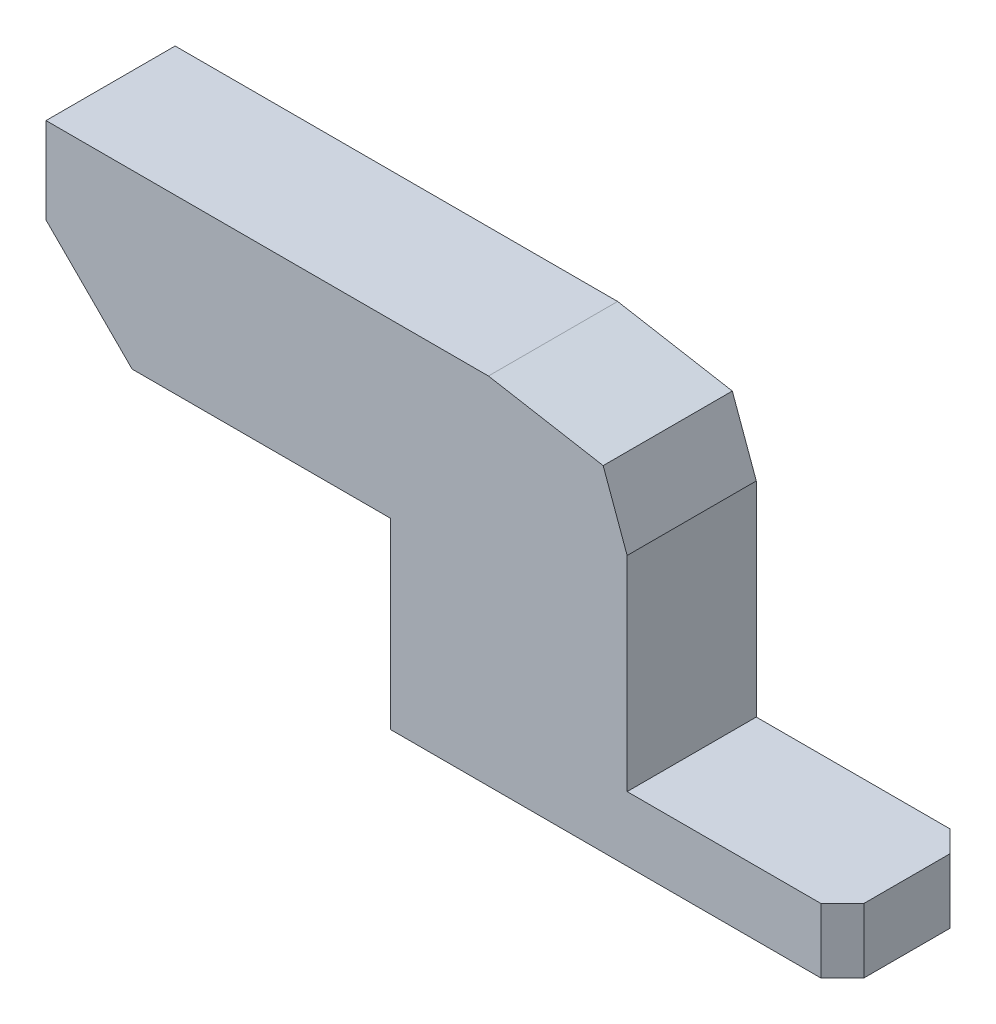
from build123d import *

# Parameters (mm, degrees)
BOSS_EXTRUDE1_DEPTH = 3
CHAMFER1_SIZE       = 1
CHAMFER3_SIZE       = 1
CHAMFER3_SIZE2      = 4.987241533
SKETCH2_R           = 1.25
CUT_EXTRUDE1_DEPTH  = 10
CHAMFER4_SIZE       = 4


with BuildPart() as part:
    # Sketch1 → Boss-Extrude1 (new, symmetric)
    with BuildSketch(Plane.XY):
        Polygon((16, 0), (37, 0), (37, 3), (27, 3), (27, 12.5), (25.544119063, 16.5), (0, 16.5), (0, 8.5), (16, 8.5), align=None)
    extrude(amount=BOSS_EXTRUDE1_DEPTH, both=True)

    # Chamfer1
    chamfer1_edges = [part.edges().sort_by_distance(p)[0] for p in [
        (37, 1.5, -3),
        (37, 1.5, 3),
    ]]
    chamfer(chamfer1_edges, length=CHAMFER1_SIZE)

    # Chamfer3
    chamfer3_edges = [part.edges().sort_by_distance(p)[0] for p in [
        (25.544119063, 16.5, 0),
    ]]
    chamfer3_side = [part.faces().sort_by_distance(p)[0] for p in [
        (26.272059531, 14.5, 0),
    ]]
    chamfer(chamfer3_edges, length=CHAMFER3_SIZE, length2=CHAMFER3_SIZE2, reference=chamfer3_side[0])

    # Sketch2 → Cut-Extrude1 (cut)
    with BuildSketch(Plane.XZ):
        with Locations((19, 0)):
            Circle(SKETCH2_R)
        with Locations((25, 0)):
            Circle(SKETCH2_R)
    extrude(amount=-CUT_EXTRUDE1_DEPTH, mode=Mode.SUBTRACT)

    # Chamfer4
    chamfer4_edges = [part.edges().sort_by_distance(p)[0] for p in [
        (0, 8.5, 0),
    ]]
    chamfer(chamfer4_edges, length=CHAMFER4_SIZE)


solid = part.part
